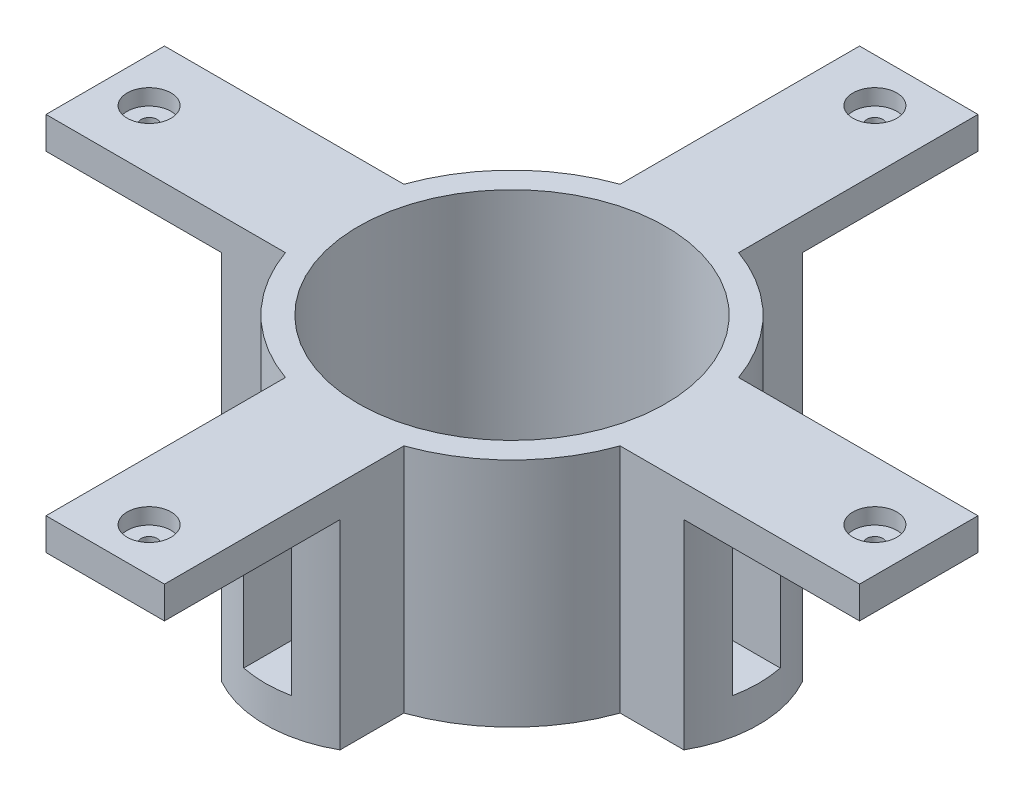
from build123d import *

# Parameters (mm, degrees)
SKETCH1_R           = 44.5
SKETCH1_R_2         = 38.5
BOSS_EXTRUDE1_DEPTH = 8
SKETCH2_R           = 2
BOSS_EXTRUDE2_DEPTH = 8
CIRPATTERN3_COUNT   = 4
BOSS_EXTRUDE3_START = -50
SKETCH5_R           = 44.5
SKETCH5_R_2         = 38.5
BOSS_EXTRUDE3_DEPTH = 50
BOSS_EXTRUDE4_START = -50
SKETCH7_R           = 2
BOSS_EXTRUDE4_DEPTH = 50
CIRPATTERN4_COUNT   = 4
CUT_EXTRUDE2_START  = 41
CUT_EXTRUDE2_DEPTH  = 41
CIRPATTERN5_COUNT   = 4
SKETCH9_R           = 5.5
CUT_EXTRUDE3_DEPTH  = 4
CIRPATTERN6_COUNT   = 4


with BuildPart() as part:
    # Sketch1 → Boss-Extrude1 (new body)
    with BuildSketch(Plane(origin=(0, 0, 0), x_dir=(1, 0, 0), z_dir=(0, 1, 0))):
        Circle(SKETCH1_R)
        Circle(SKETCH1_R_2, mode=Mode.SUBTRACT)
    extrude(amount=BOSS_EXTRUDE1_DEPTH)

    # Sketch2 → Boss-Extrude2 (add)
    with BuildSketch(Plane(origin=(0, 0, 0), x_dir=(1, 0, 0), z_dir=(0, 1, 0))):
        with BuildLine():
            Line((41.951101238, 14.844362731), (101.951101238, 14.844362731))
            Line((101.951101238, 14.844362731), (101.951101238, -14.844362731))
            Line((101.951101238, -14.844362731), (41.951101238, -14.844362731))
            ThreePointArc((41.951101238, -14.844362731), (44.5, 0), (41.951101238, 14.844362731))
        make_face()
        with Locations((90.951101238, 0)):
            Circle(SKETCH2_R, mode=Mode.SUBTRACT)
    boss_extrude2 = extrude(amount=BOSS_EXTRUDE2_DEPTH)

    # CirPattern3: Boss-Extrude2 ×4 about axis
    cirpattern3_axis = Axis((0, 8, 0), (0, -1, 0))
    for i in range(1, CIRPATTERN3_COUNT):
        add(boss_extrude2.rotate(cirpattern3_axis, i * 360 / CIRPATTERN3_COUNT))

    # Sketch5 → Boss-Extrude3 (add)
    with BuildSketch(Plane(origin=(0, 0, 0), x_dir=(1, 0, 0), z_dir=(0, 1, 0)).offset(BOSS_EXTRUDE3_START)):
        Circle(SKETCH5_R)
        Circle(SKETCH5_R_2, mode=Mode.SUBTRACT)
    extrude(amount=BOSS_EXTRUDE3_DEPTH)

    # Sketch7 → Boss-Extrude4 (add)
    with BuildSketch(Plane(origin=(0, 0, 0), x_dir=(1, 0, 0), z_dir=(0, 1, 0)).offset(BOSS_EXTRUDE4_START)):
        with BuildLine():
            Line((41.951101238, 14.844362731), (57.951101238, 14.844362731))
            ThreePointArc((57.951101238, 14.844362731), (61.83977211, 0), (57.951101238, -14.844362731))
            Line((57.951101238, -14.844362731), (41.951101238, -14.844362731))
            ThreePointArc((41.951101238, -14.844362731), (44.5, 0), (41.951101238, 14.844362731))
        make_face()
        with Locations((51.9, 0)):
            Circle(SKETCH7_R, mode=Mode.SUBTRACT)
    boss_extrude4 = extrude(amount=BOSS_EXTRUDE4_DEPTH)

    # CirPattern4: Boss-Extrude4 ×4 about axis
    cirpattern4_axis = Axis((0, 8, 0), (0, -1, 0))
    for i in range(1, CIRPATTERN4_COUNT):
        add(boss_extrude4.rotate(cirpattern4_axis, i * 360 / CIRPATTERN4_COUNT))

    # Sketch8 → Cut-Extrude2 (cut)
    with BuildSketch(Plane.XZ.offset(CUT_EXTRUDE2_START)):
        with BuildLine():
            Line((61.239313057, -6), (45.9, -6))
            Line((45.9, -6), (45.9, 6))
            Line((45.9, 6), (61.239313057, 6))
            ThreePointArc((61.239313057, 6), (61.83977211, 0), (61.239313057, -6))
        make_face()
    cut_extrude2 = extrude(amount=-CUT_EXTRUDE2_DEPTH, mode=Mode.SUBTRACT)

    # CirPattern5: Cut-Extrude2 ×4 about axis
    cirpattern5_axis = Axis((0, 8, 0), (0, -1, 0))
    for i in range(1, CIRPATTERN5_COUNT):
        add(cut_extrude2.rotate(cirpattern5_axis, i * 360 / CIRPATTERN5_COUNT), mode=Mode.SUBTRACT)

    # Sketch9 → Cut-Extrude3 (cut)
    with BuildSketch(Plane(origin=(0, 8, 0), x_dir=(1, 0, 0), z_dir=(0, 1, 0))):
        with Locations((90.951101238, 0)):
            Circle(SKETCH9_R)
    cut_extrude3 = extrude(amount=-CUT_EXTRUDE3_DEPTH, mode=Mode.SUBTRACT)

    # CirPattern6: Cut-Extrude3 ×4 about axis
    cirpattern6_axis = Axis((0, 8, 0), (0, -1, 0))
    for i in range(1, CIRPATTERN6_COUNT):
        add(cut_extrude3.rotate(cirpattern6_axis, i * 360 / CIRPATTERN6_COUNT), mode=Mode.SUBTRACT)


solid = part.part
